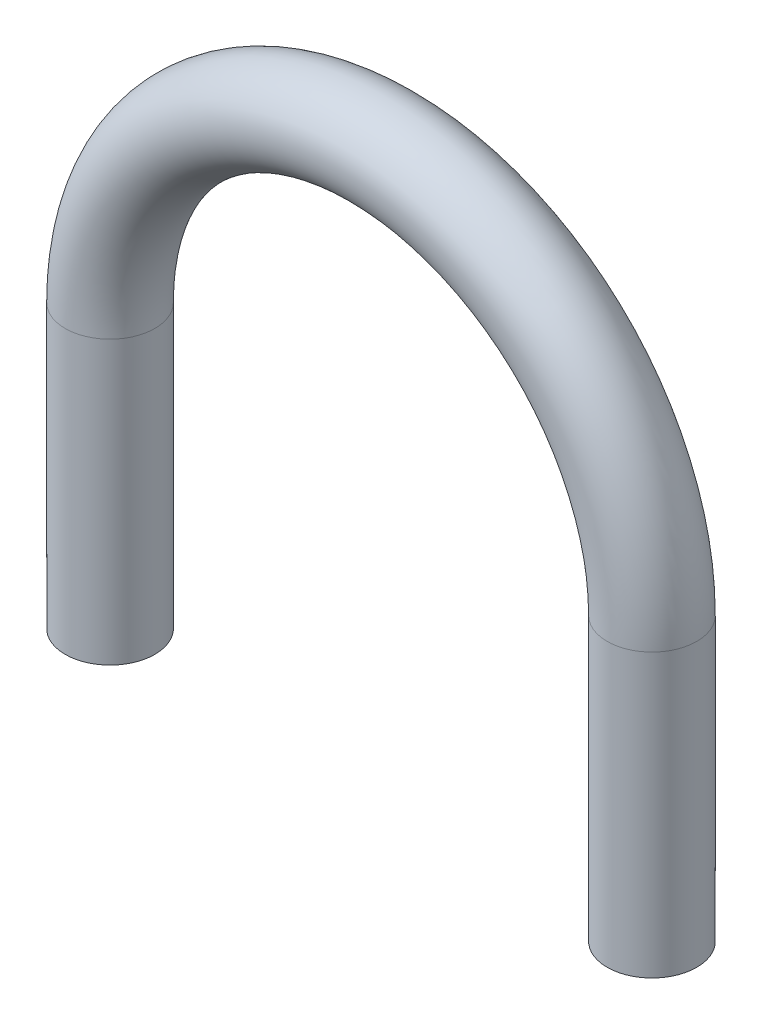
from build123d import *

# Parameters (mm, degrees)
BALAYAGE3_PROFILE_R = 3.175


with BuildPart() as part:
    # Balayage3: sweep along a path in Esquisse1
    with BuildLine(Plane.XY) as balayage3_path:
        Line((-19.2, -20), (-19.2, 0))
        ThreePointArc((-19.2, 0), (0, 19.2), (19.2, 0))
        Line((19.2, 0), (19.2, -20))
    # Balayage3 profile (on start of the path) → Balayage3 (sweep)
    with BuildSketch(Plane(origin=(-19.2, -20, 0), x_dir=(0, 0, 1), z_dir=(0, 1, 0))):
        Circle(BALAYAGE3_PROFILE_R)
    sweep(path=balayage3_path.line)


solid = part.part
